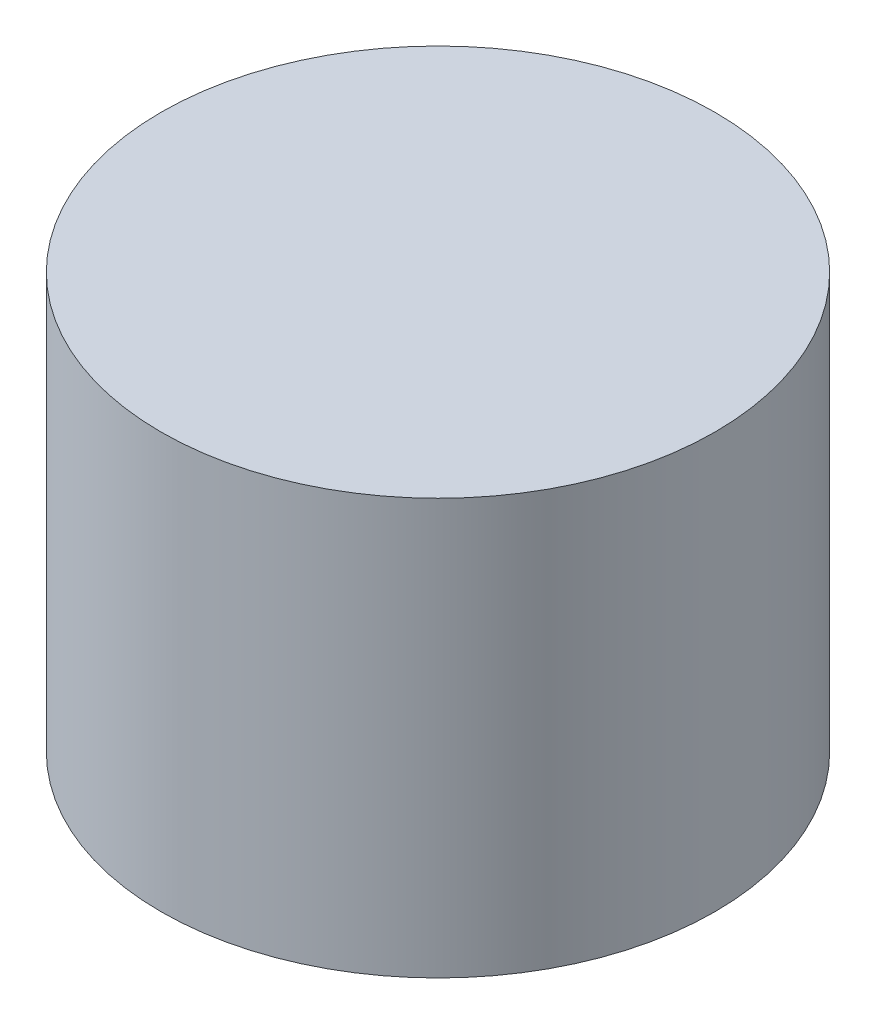
from build123d import *

# Parameters (mm, degrees)
SKETCH1_R           = 1
BOSS_EXTRUDE1_DEPTH = 1.5


with BuildPart() as part:
    # Sketch1 → Boss-Extrude1 (new body)
    with BuildSketch(Plane(origin=(0, 0, 0), x_dir=(1, 0, 0), z_dir=(0, 1, 0))):
        Circle(SKETCH1_R)
    extrude(amount=BOSS_EXTRUDE1_DEPTH)


solid = part.part
